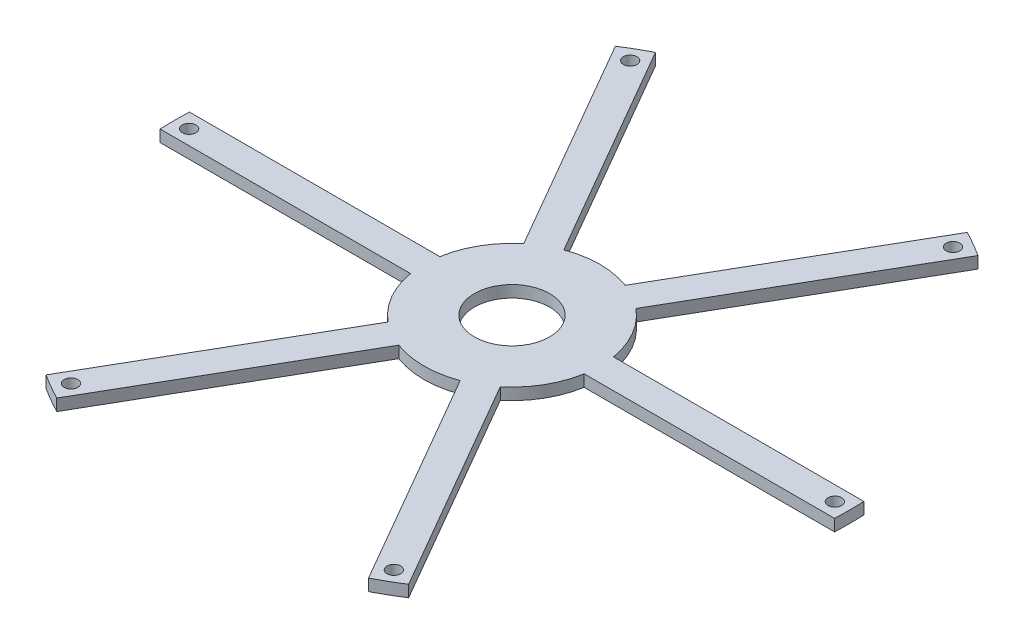
from build123d import *

# Parameters (mm, degrees)
BOSS_EXTRUDE1_DEPTH         = 2.54
F_5_8_CLEARANCE_HOLE1_D     = 16.27124
F_5_8_CLEARANCE_HOLE1_DEPTH = 38.354
F_5_8_CLEARANCE_HOLE1_TIP   = 4.888373669
F_4_CLEARANCE_HOLE1_D       = 2.9464
F_4_CLEARANCE_HOLE1_DEPTH   = 38.354
F_4_CLEARANCE_HOLE1_TIP     = 0.885187864


with BuildPart() as part:
    # Sketch1 → Boss-Extrude1 (new body)
    with BuildSketch(Plane(origin=(0, 0, 0), x_dir=(1, 0, 0), z_dir=(0, 1, 0))):
        with BuildLine():
            Line((18.783553311, 3.175), (72.955945611, 3.175))
            ThreePointArc((72.955945611, 3.175), (73.025, 0), (72.955945611, -3.175))
            Line((72.955945611, -3.175), (18.783553311, -3.175))
            ThreePointArc((18.783553311, -3.175), (16.497783942, -9.525), (12.141407313, -14.679534341))
            Line((12.141407313, -14.679534341), (39.227603463, -61.594202256))
            ThreePointArc((39.227603463, -61.594202256), (36.5125, -63.241505111), (33.728342149, -64.769202256))
            Line((33.728342149, -64.769202256), (6.642145999, -17.854534341))
            ThreePointArc((6.642145999, -17.854534341), (0, -19.05), (-6.642145999, -17.854534341))
            Line((-6.642145999, -17.854534341), (-33.728342149, -64.769202256))
            ThreePointArc((-33.728342149, -64.769202256), (-36.5125, -63.241505111), (-39.227603463, -61.594202256))
            Line((-39.227603463, -61.594202256), (-12.141407313, -14.679534341))
            ThreePointArc((-12.141407313, -14.679534341), (-16.497783942, -9.525), (-18.783553311, -3.175))
            Line((-18.783553311, -3.175), (-72.955945611, -3.175))
            ThreePointArc((-72.955945611, -3.175), (-73.025, 0), (-72.955945611, 3.175))
            Line((-72.955945611, 3.175), (-18.783553311, 3.175))
            ThreePointArc((-18.783553311, 3.175), (-16.497783942, 9.525), (-12.141407313, 14.679534341))
            Line((-12.141407313, 14.679534341), (-39.227603463, 61.594202256))
            ThreePointArc((-39.227603463, 61.594202256), (-36.5125, 63.241505111), (-33.728342149, 64.769202256))
            Line((-33.728342149, 64.769202256), (-6.642145999, 17.854534341))
            ThreePointArc((-6.642145999, 17.854534341), (0, 19.05), (6.642145999, 17.854534341))
            Line((6.642145999, 17.854534341), (33.728342149, 64.769202256))
            ThreePointArc((33.728342149, 64.769202256), (36.5125, 63.241505111), (39.227603463, 61.594202256))
            Line((39.227603463, 61.594202256), (12.141407313, 14.679534341))
            ThreePointArc((12.141407313, 14.679534341), (16.497783942, 9.525), (18.783553311, 3.175))
        make_face()
    extrude(amount=BOSS_EXTRUDE1_DEPTH)

    # 5/8 Clearance Hole1
    with Locations(Plane(origin=(0, 2.54, 0), x_dir=(1, 0, 0), z_dir=(0, 1, 0))):
        with Locations((0, 0)):
            Hole(F_5_8_CLEARANCE_HOLE1_D / 2, depth=F_5_8_CLEARANCE_HOLE1_DEPTH)
            with Locations((0, 0, -(F_5_8_CLEARANCE_HOLE1_DEPTH + F_5_8_CLEARANCE_HOLE1_TIP / 2))):  # 118° drill point
                Cone(0, F_5_8_CLEARANCE_HOLE1_D / 2, F_5_8_CLEARANCE_HOLE1_TIP, mode=Mode.SUBTRACT)

    # #4 Clearance Hole1
    with Locations(Plane(origin=(0, 2.54, 0), x_dir=(1, 0, 0), z_dir=(0, 1, 0))):
        with Locations((-69.85, 0), (-34.925, 60.491874454), (34.925, 60.491874454), (69.85, 0), (34.925, -60.491874454), (-34.925, -60.491874454)):
            Hole(F_4_CLEARANCE_HOLE1_D / 2, depth=F_4_CLEARANCE_HOLE1_DEPTH)
            with Locations((0, 0, -(F_4_CLEARANCE_HOLE1_DEPTH + F_4_CLEARANCE_HOLE1_TIP / 2))):  # 118° drill point
                Cone(0, F_4_CLEARANCE_HOLE1_D / 2, F_4_CLEARANCE_HOLE1_TIP, mode=Mode.SUBTRACT)


solid = part.part
